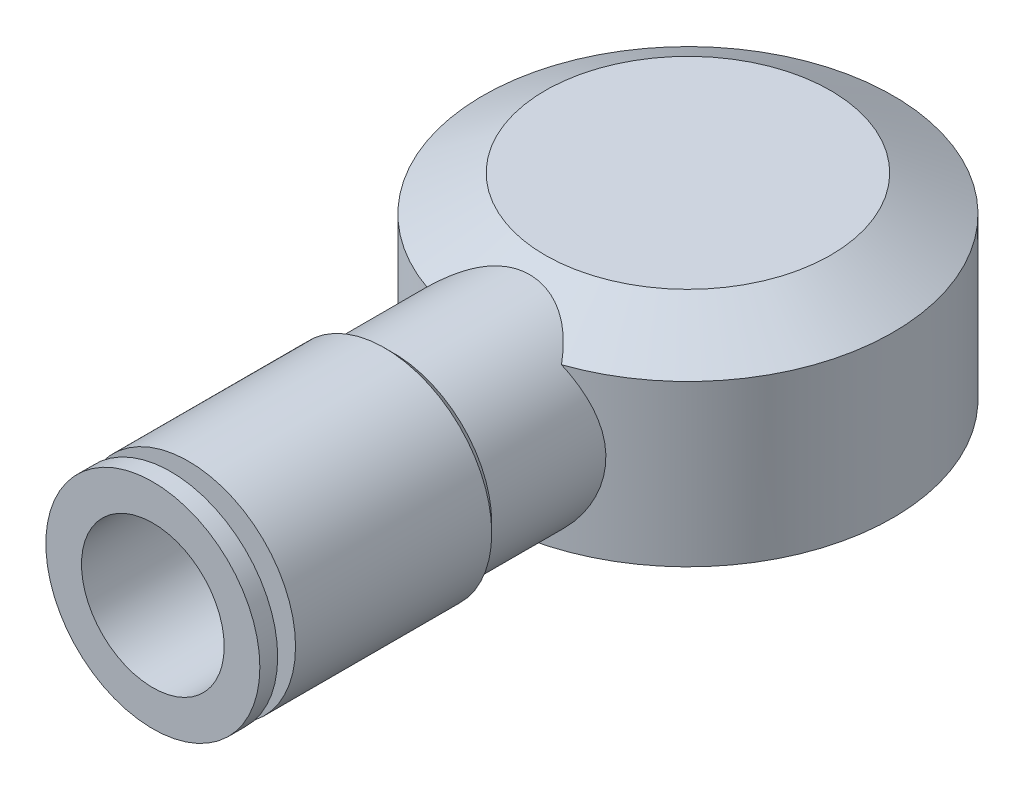
from build123d import *

# Parameters (mm, degrees)
SKETCH2_R           = 5.5
BOSS_EXTRUDE4_DEPTH = 30
CUT_EXTRUDE1_START  = -2
SKETCH3_R           = 5.5
SKETCH3_R_2         = 4.5
CUT_EXTRUDE1_DEPTH  = 1
SKETCH5_R           = 11.5
CUT_EXTRUDE3_DEPTH  = 6
SKETCH8_R           = 4
CUT_EXTRUDE4_DEPTH  = 34
CUT_EXTRUDE6_START  = -1
SKETCH9_R           = 7
CUT_EXTRUDE6_DEPTH  = 34
BOSS_EXTRUDE5_START = -1
SKETCH10_R          = 6
SKETCH10_R_2        = 5.5
BOSS_EXTRUDE5_DEPTH = 1
BOSS_EXTRUDE6_START = -12
SKETCH11_R          = 6
SKETCH11_R_2        = 5.5
BOSS_EXTRUDE6_DEPTH = 12
CHAMFER1_SIZE       = 1


with BuildPart() as part:
    # Sketch1 → Revolve2 (revolve)
    with BuildSketch(Plane.XY, mode=Mode.PRIVATE) as revolve2_sk:
        Polygon((11.5, 3.5), (8, 5.5), (0, 5.5), (0, -5.5), (11.5, -5.5), align=None)
    revolve(revolve2_sk.sketch.rotate(Axis((0, 5.5, 0), (0, -1, 0)), 90), axis=Axis((0, 5.5, 0), (0, -1, 0)))

    # Sketch2 → Boss-Extrude4 (add)
    with BuildSketch(Plane.XY):
        with Locations(Location((0, -0.5, 0), (0, 0, 133.341758512))):
            Circle(SKETCH2_R)
    extrude(amount=BOSS_EXTRUDE4_DEPTH)

    # Sketch3 → Cut-Extrude1 (cut)
    with BuildSketch(Plane.XY.offset(30).offset(CUT_EXTRUDE1_START)):
        with Locations(Location((0, -0.5, 0), (0, 0, 133.341758512))):
            Circle(SKETCH3_R)
        with Locations((0, -0.5)):
            Circle(SKETCH3_R_2, mode=Mode.SUBTRACT)
    extrude(amount=CUT_EXTRUDE1_DEPTH, mode=Mode.SUBTRACT)

    # Sketch5 → Cut-Extrude3 (cut)
    with BuildSketch(Plane.XZ.offset(5.5)):
        Circle(SKETCH5_R)
    extrude(amount=CUT_EXTRUDE3_DEPTH, mode=Mode.SUBTRACT)

    # Sketch8 → Cut-Extrude4 (cut)
    with BuildSketch(Plane.XY.offset(30)):
        with Locations((0, -0.5)):
            Circle(SKETCH8_R)
    extrude(amount=-CUT_EXTRUDE4_DEPTH, mode=Mode.SUBTRACT)

    # Sketch9 → Cut-Extrude6 (cut)
    with BuildSketch(Plane(origin=(0, 5.5, 0), x_dir=(1, 0, 0), z_dir=(0, 1, 0)).offset(CUT_EXTRUDE6_START)):
        with Locations(Location((0, 0, 0), (0, 0, 270))):
            Circle(SKETCH9_R)
    extrude(amount=-CUT_EXTRUDE6_DEPTH, mode=Mode.SUBTRACT)

    # Sketch10 → Boss-Extrude5 (add)
    with BuildSketch(Plane.XY.offset(30).offset(BOSS_EXTRUDE5_START)):
        with Locations((0, -0.5)):
            Circle(SKETCH10_R)
        with Locations(Location((0, -0.5, 0), (0, 0, 133.341758512))):
            Circle(SKETCH10_R_2, mode=Mode.SUBTRACT)
    extrude(amount=BOSS_EXTRUDE5_DEPTH)

    # Sketch11 → Boss-Extrude6 (add)
    with BuildSketch(Plane.XY.offset(28).offset(BOSS_EXTRUDE6_START)):
        with Locations((0, -0.5)):
            Circle(SKETCH11_R)
        with Locations(Location((0, -0.5, 0), (0, 0, 133.341758512))):
            Circle(SKETCH11_R_2, mode=Mode.SUBTRACT)
    extrude(amount=BOSS_EXTRUDE6_DEPTH)

    # Chamfer1
    # the kernel refuses this chamfer: 1 mm, written as the material it takes off along each edge
    with BuildSketch(Plane(origin=(0, -0.5, 16), x_dir=(1, 0, 0), z_dir=(0, -1, 0))) as chamfer1_piece_1_section:
        Polygon((6 - CHAMFER1_SIZE, 0), (6, CHAMFER1_SIZE), (6, 0), align=None)
    chamfer1_piece_1 = revolve(axis=Axis((0, -0.5, 16), (0, 0, 1)), mode=Mode.PRIVATE)
    chamfer1_piece_1 = chamfer1_piece_1 - Plane(origin=(0, -0.5, 16.746748463), x_dir=(-0.6863485886393825, 0.7272727238613639, 0), z_dir=(0, 0, -1)) * Cylinder(5.5, 25, mode=Mode.PRIVATE)
    add(chamfer1_piece_1, mode=Mode.SUBTRACT)


solid = part.part
